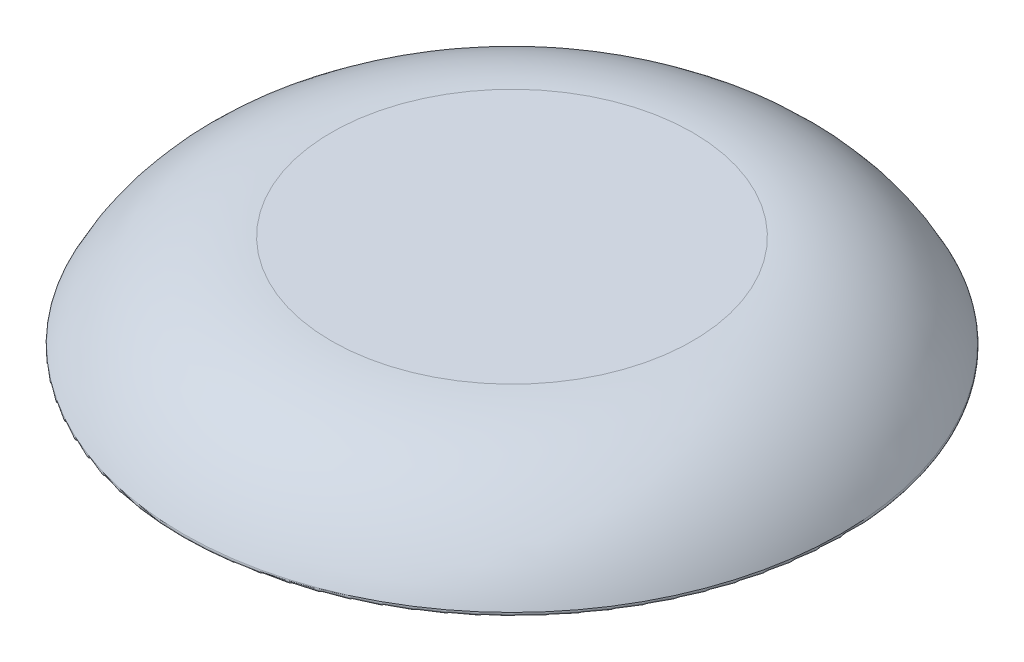
from build123d import *

# Parameters (mm, degrees)
STOCK_DISK_1_START       = 20
STOCK_DISK_1_OUTLINE_R   = 40
STOCK_DISK_1_OUTLINE_R_2 = 5.4
STOCK_DISK_1_DEPTH       = 17.5
STOCK_DISK_1_START_2     = 33.5
STOCK_DISK_1_2_OUTLINE_R = 5.4
STOCK_DISK_1_2_DEPTH     = 4
SKETCH3_R                = 60
SKETCH3_R_2              = 40
BOSS_EXTRUDE2_DEPTH      = 17.5
FILLET4_R                = 30
FILLET5_R                = 0.5


# Read off the part's stored shape, not the designer's step: Stock-disk-1
with BuildPart() as part:
    # Stock-disk-1 outline → Stock-disk-1 (new body)
    with BuildSketch(Plane(origin=(0, 0, 0), x_dir=(1, 0, 0), z_dir=(0, 1, 0)).offset(STOCK_DISK_1_START)):
        Circle(STOCK_DISK_1_OUTLINE_R)
        with Locations((-21.213203436, -21.213203436)):
            Circle(STOCK_DISK_1_OUTLINE_R_2, mode=Mode.SUBTRACT)
        with BuildLine():
            ThreePointArc((-4.279550271, -18.511765164), (-0.396644977, -18.995859358), (3.503083449, -18.67427124))
            Line((3.503083449, -18.67427124), (4.97915355, -27.045480767))
            ThreePointArc((4.97915355, -27.045480767), (-0.396540251, -27.497140866), (-5.756974355, -26.890653512))
            Line((-5.756974355, -26.890653512), (-4.279550271, -18.511765164))
        make_face(mode=Mode.SUBTRACT)
        with Locations((21.213203436, -21.213203436)):
            Circle(STOCK_DISK_1_OUTLINE_R_2, mode=Mode.SUBTRACT)
        with BuildLine():
            Line((18.67427124, 3.503083449), (27.045480767, 4.97915355))
            ThreePointArc((27.045480767, 4.97915355), (27.497140866, -0.396540251), (26.890653512, -5.756974355))
            Line((26.890653512, -5.756974355), (18.511765164, -4.279550271))
            ThreePointArc((18.511765164, -4.279550271), (18.995859358, -0.396644977), (18.67427124, 3.503083449))
        make_face(mode=Mode.SUBTRACT)
        with BuildLine():
            ThreePointArc((-18.511765164, 4.279550271), (-18.995859358, 0.396644977), (-18.67427124, -3.503083449))
            Line((-18.67427124, -3.503083449), (-27.045480767, -4.97915355))
            ThreePointArc((-27.045480767, -4.97915355), (-27.497140866, 0.396540251), (-26.890653512, 5.756974355))
            Line((-26.890653512, 5.756974355), (-18.511765164, 4.279550271))
        make_face(mode=Mode.SUBTRACT)
        with Locations((-21.213203436, 21.213203436)):
            Circle(STOCK_DISK_1_OUTLINE_R_2, mode=Mode.SUBTRACT)
        with BuildLine():
            Line((-3.503083449, 18.67427124), (-4.97915355, 27.045480767))
            ThreePointArc((-4.97915355, 27.045480767), (0.396540251, 27.497140866), (5.756974355, 26.890653512))
            Line((5.756974355, 26.890653512), (4.279550271, 18.511765164))
            ThreePointArc((4.279550271, 18.511765164), (0.396644977, 18.995859358), (-3.503083449, 18.67427124))
        make_face(mode=Mode.SUBTRACT)
        with Locations((21.213203436, 21.213203436)):
            Circle(STOCK_DISK_1_OUTLINE_R_2, mode=Mode.SUBTRACT)
    extrude(amount=STOCK_DISK_1_DEPTH)

    # Stock-disk-1 2 outline → Stock-disk-1 2 (add)
    with BuildSketch(Plane(origin=(0, 0, 0), x_dir=(1, 0, 0), z_dir=(0, 1, 0)).offset(STOCK_DISK_1_START_2)):
        with Locations((-21.213203436, -21.213203436)):
            Circle(STOCK_DISK_1_2_OUTLINE_R)
        with BuildLine():
            Line((-27.045480767, -4.97915355), (-18.67427124, -3.503083449))
            ThreePointArc((-18.67427124, -3.503083449), (-18.995859358, 0.396644977), (-18.511765164, 4.279550271))
            Line((-18.511765164, 4.279550271), (-26.890653512, 5.756974355))
            ThreePointArc((-26.890653512, 5.756974355), (-27.497140866, 0.396540251), (-27.045480767, -4.97915355))
        make_face()
        with Locations((-21.213203436, 21.213203436)):
            Circle(STOCK_DISK_1_2_OUTLINE_R)
        with Locations((21.213203436, 21.213203436)):
            Circle(STOCK_DISK_1_2_OUTLINE_R)
        with Locations((21.213203436, -21.213203436)):
            Circle(STOCK_DISK_1_2_OUTLINE_R)
        with BuildLine():
            ThreePointArc((5.756974355, 26.890653512), (0.396540251, 27.497140866), (-4.97915355, 27.045480767))
            Line((-4.97915355, 27.045480767), (-3.503083449, 18.67427124))
            ThreePointArc((-3.503083449, 18.67427124), (0.396644977, 18.995859358), (4.279550271, 18.511765164))
            Line((4.279550271, 18.511765164), (5.756974355, 26.890653512))
        make_face()
        with BuildLine():
            ThreePointArc((26.890653512, -5.756974355), (27.497140866, -0.396540251), (27.045480767, 4.97915355))
            Line((27.045480767, 4.97915355), (18.67427124, 3.503083449))
            ThreePointArc((18.67427124, 3.503083449), (18.995859358, -0.396644977), (18.511765164, -4.279550271))
            Line((18.511765164, -4.279550271), (26.890653512, -5.756974355))
        make_face()
        with BuildLine():
            Line((4.97915355, -27.045480767), (3.503083449, -18.67427124))
            ThreePointArc((3.503083449, -18.67427124), (-0.396644977, -18.995859358), (-4.279550271, -18.511765164))
            Line((-4.279550271, -18.511765164), (-5.756974355, -26.890653512))
            ThreePointArc((-5.756974355, -26.890653512), (-0.396540251, -27.497140866), (4.97915355, -27.045480767))
        make_face()
    extrude(amount=STOCK_DISK_1_2_DEPTH)

    # Sketch3 → Boss-Extrude2 (add)
    with BuildSketch(Plane.XZ.offset(-20)):
        with Locations(Location((0, 0, 0), (0, 0, 270))):
            Circle(SKETCH3_R)
        Circle(SKETCH3_R_2, mode=Mode.SUBTRACT)
    extrude(amount=-BOSS_EXTRUDE2_DEPTH)

    # Fillet4
    # the kernel refuses this fillet: 30 mm, written as the material it takes off along each edge
    with BuildSketch(Plane(origin=(0, 37.5, 0), x_dir=(0, 0, -1), z_dir=(-1, 0, 0))) as fillet4_piece_1:
        with BuildLine():
            CenterArc((32.728219713, 30), FILLET4_R, 270, 65.375681648)
            Line((32.728219713, 0), (32.728219713, -0.6))
            Line((32.728219713, -0.6), (60, -0.6))
            Line((60, -0.6), (60.6, 0))
            ThreePointArc((60.6, 0), (60.6, 8.75), (60.545435606, 17.25))
            Line((60.545435606, 17.25), (60, 17.5))
        make_face()
    revolve(axis=Axis((0, 37.5, 0), (0, -1, 0)), mode=Mode.SUBTRACT)

    # Fillet5
    fillet5_edges = [part.edges().sort_by_distance(p)[0] for p in [
        (0, 20, 60),
    ]]
    fillet(fillet5_edges, radius=FILLET5_R)

    # Sketch4 → Cut-Revolve7 (revolve, cut)
    with BuildSketch(Plane.XY):
        with BuildLine():
            Line((0, 32.838422871), (0, -32.838422871))
            add(Edge.make_bspline(
                [(0, 32.838422871), (-70, 32.838422871), (-70, 0), (-70, -32.838422871), (0, -32.838422871)],
                knots=[4.71238898, 4.71238898, 4.71238898, 6.283185307, 6.283185307, 7.853981634, 7.853981634, 7.853981634], degree=2, weights=[1, 0.707106781, 1, 0.707106781, 1]))
        make_face()
    revolve(axis=Axis((0, 32.838422871, 0), (0, -1, 0)), mode=Mode.SUBTRACT)


solid = part.part
